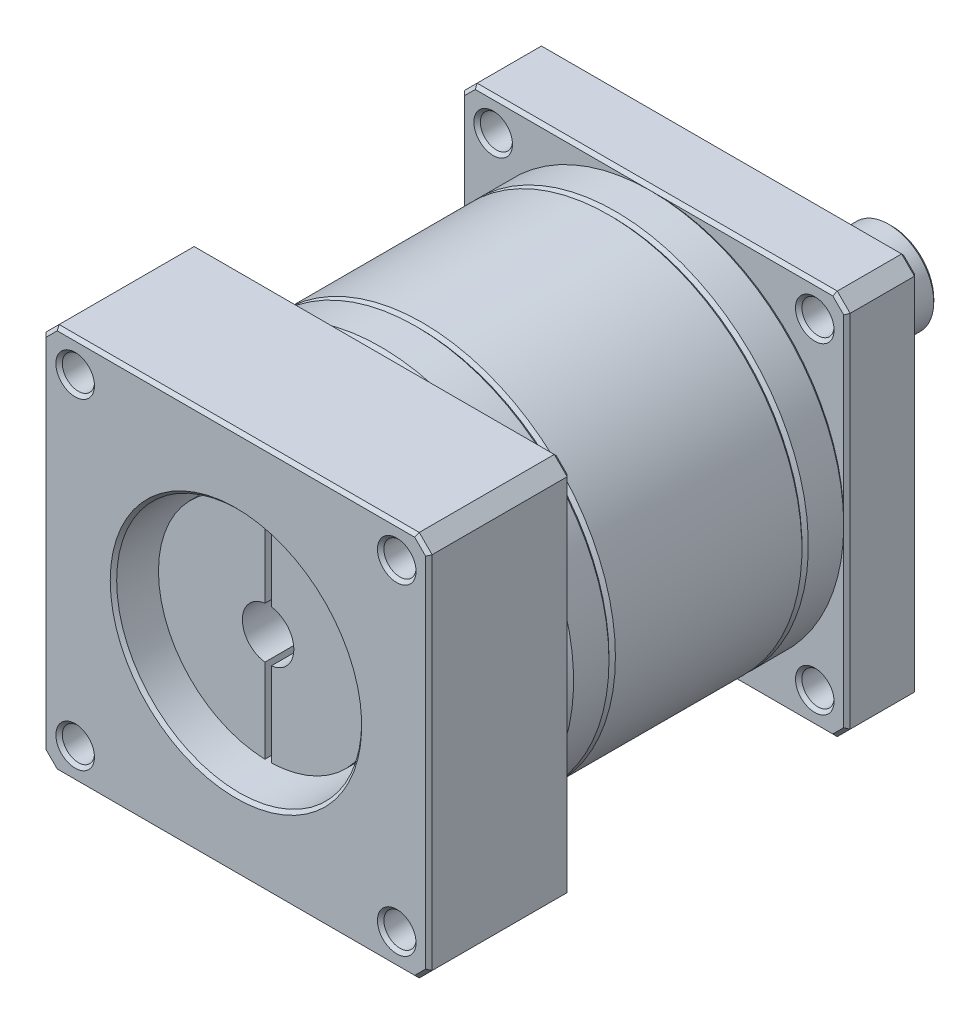
from build123d import *

# Parameters (mm, degrees)
SKETCH1_W                = 60
SKETCH1_H                = 60
EXTRUDE1_DEPTH           = 11
SKETCH2_R                = 30
EXTRUDE2_DEPTH           = 76
SKETCH3_W                = 60
SKETCH3_H                = 60
EXTRUDE3_DEPTH           = 22
SKETCH4_R                = 2.5
EXTRUDE4_DEPTH           = 88.040220588
CHAMFER1_SIZE            = 2
SKETCH6_R                = 19.05
EXTRUDE5_DEPTH           = 5
SKETCH7_R                = 19.05
SKETCH7_R_2              = 17.05
SKETCH7_R_3              = 4
EXTRUDE6_DEPTH           = 26
SKETCH8_R                = 21
EXTRUDE7_DEPTH           = 3
SKETCH9_R                = 7
EXTRUDE8_DEPTH           = 26
SKETCH10_R               = 8
EXTRUDE9_DEPTH           = 6
SPLIT1_START             = -26
SPLIT1_OUTLINE_R         = 7
SPLIT1_DEPTH             = 76
SPLIT1_START_2           = -6
SPLIT1_2_OUTLINE_R       = 8
SPLIT1_2_OUTLINE_R_2     = 4
SPLIT1_2_DEPTH           = 77
SPLIT1_START_3           = -3
SPLIT1_3_OUTLINE_R       = 10
SPLIT1_3_OUTLINE_R_2     = 8
SPLIT1_3_DEPTH           = 74
SPLIT1_4_OUTLINE_R       = 15
SPLIT1_4_OUTLINE_R_2     = 10
SPLIT1_4_DEPTH           = 74
SPLIT1_5_OUTLINE_R       = 17
SPLIT1_5_OUTLINE_R_2     = 15
SPLIT1_5_DEPTH           = 74
SPLIT1_6_OUTLINE_R       = 17
SPLIT1_6_DEPTH           = 97
CHAMFER2_SIZE            = 0.2
CHAMFER3_SIZE            = 0.2
CHAMFER4_SIZE            = 0.2
CHAMFER5_SIZE            = 0.5
CHAMFER6_SIZE            = 0.5
CHAMFER7_SIZE            = 0.5
EXTRUDE10_DEPTH          = 21
SPLIT2_START             = 11
SPLIT2_OUTLINE_R         = 2.5
SPLIT2_DEPTH             = 65
SPLIT2_START_2           = 54
SPLIT2_2_OUTLINE_R       = 2.5
SPLIT2_2_OUTLINE_R_2     = 19.05
SPLIT2_2_DEPTH           = 22
SPLIT2_3_OUTLINE_R       = 30
SPLIT2_3_DEPTH           = 39
SPLIT2_START_3           = 50
SPLIT2_4_OUTLINE_R       = 30
SPLIT2_4_OUTLINE_R_2     = 19.05
SPLIT2_4_DEPTH           = 4
SPLIT2_5_DEPTH           = 17
SPLIT2_6_DEPTH           = 17
CHAMFER8_SIZE            = 0.5
CHAMFER9_SIZE            = 0.5
CHAMFER10_SIZE           = 0.5
CHAMFER11_SIZE           = 0.5
SPLIT3_SURFACE_1_1_BACK  = 133.68
SPLIT3_SURFACE_1_1_DEPTH = 267.36
SPLIT3_SURFACE_1_2_BACK  = 133.68
SPLIT3_SURFACE_1_2_DEPTH = 267.36
SPLIT3_SURFACE_2_3_BACK  = 133.68
SPLIT3_SURFACE_2_3_DEPTH = 267.36
SPLIT3_SURFACE_2_4_BACK  = 133.68
SPLIT3_SURFACE_2_4_DEPTH = 267.36
CHAMFER12_SIZE           = 0.5
CHAMFER13_SIZE           = 0.5
CHAMFER14_SIZE           = 0.5


# Read off the part's stored shape, not the designer's step: Split1, Split2
with BuildPart() as part:
    # Sketch1 → Extrude1 (new body)
    with BuildSketch(Plane.XY):
        Rectangle(SKETCH1_W, SKETCH1_H)
    extrude(amount=EXTRUDE1_DEPTH)

    # Sketch2 → Extrude2 (add)
    with BuildSketch(Plane(origin=(0, 0, 0), x_dir=(-1, 0, 0), z_dir=(0, 0, -1))):
        Circle(SKETCH2_R)
    extrude(amount=-EXTRUDE2_DEPTH)

    # Sketch3 → Extrude3 (add)
    with BuildSketch(Plane.XY.offset(76)):
        Rectangle(SKETCH3_W, SKETCH3_H)
    extrude(amount=-EXTRUDE3_DEPTH)

    # Sketch4 → Extrude4 (cut, through all)
    with BuildSketch(Plane(origin=(0, 0, 0), x_dir=(-1, 0, 0), z_dir=(0, 0, -1))):
        with Locations((-25, 25)):
            Circle(SKETCH4_R)
        with Locations((25, 25)):
            Circle(SKETCH4_R)
        with Locations((25, -25)):
            Circle(SKETCH4_R)
        with Locations((-25, -25)):
            Circle(SKETCH4_R)
    extrude(amount=-EXTRUDE4_DEPTH, mode=Mode.SUBTRACT)

    # Chamfer1
    chamfer1_edges = [part.edges().sort_by_distance(p)[0] for p in [
        (-30, 30, 65),
        (30, 30, 65),
        (30, -30, 65),
        (-30, -30, 65),
        (30, -30, 5.5),
        (-30, -30, 5.5),
        (-30, 30, 5.5),
        (30, 30, 5.5),
    ]]
    chamfer(chamfer1_edges, length=CHAMFER1_SIZE)

    # Sketch6 → Extrude5 (cut)
    with BuildSketch(Plane.XY.offset(76)):
        Circle(SKETCH6_R)
    extrude(amount=-EXTRUDE5_DEPTH, mode=Mode.SUBTRACT)

    # Sketch7 → Extrude6 (cut)
    # profile 1 of 2: a face of its own
    with BuildSketch(Plane.XY.offset(76)):
        Circle(SKETCH7_R)
        Circle(SKETCH7_R_2, mode=Mode.SUBTRACT)
    # profile 2 of 2: a face of its own
    with BuildSketch(Plane.XY.offset(76)):
        Circle(SKETCH7_R_3)
    extrude(amount=-EXTRUDE6_DEPTH, mode=Mode.SUBTRACT)

    # Sketch8 → Extrude7 (add)
    with BuildSketch(Plane(origin=(0, 0, 0), x_dir=(-1, 0, 0), z_dir=(0, 0, -1))):
        with Locations(Location((0, 0, 0), (0, 0, 180))):
            Circle(SKETCH8_R)
    extrude(amount=EXTRUDE7_DEPTH)

    # Sketch9 → Extrude8 (add)
    with BuildSketch(Plane(origin=(0, 0, 0), x_dir=(-1, 0, 0), z_dir=(0, 0, -1))):
        with Locations(Location((0, 0, 0), (0, 0, 180))):
            Circle(SKETCH9_R)
    extrude(amount=EXTRUDE8_DEPTH)

    # Sketch10 → Extrude9 (add)
    with BuildSketch(Plane(origin=(0, 0, 0), x_dir=(-1, 0, 0), z_dir=(0, 0, -1))):
        Circle(SKETCH10_R)
    extrude(amount=EXTRUDE9_DEPTH)

    # Split1 6 outline → Split1 6 (cut)
    with BuildSketch(Plane.XY.offset(SPLIT1_START)):
        Circle(SPLIT1_6_OUTLINE_R)
    extrude(amount=SPLIT1_6_DEPTH, mode=Mode.SUBTRACT)

    # Chamfer5
    chamfer5_edges = [part.edges().sort_by_distance(p)[0] for p in [
        (-21, 0, -3),
        (-17, 0, -3),
    ]]
    chamfer(chamfer5_edges, length=CHAMFER5_SIZE)


with BuildPart() as body_2:
    # Split1 outline → Split1 (new body)
    with BuildSketch(Plane.XY.offset(SPLIT1_START)):
        Circle(SPLIT1_OUTLINE_R)
    extrude(amount=SPLIT1_DEPTH)

    # Split1 2 outline → Split1 2 (add)
    with BuildSketch(Plane.XY.offset(SPLIT1_START_2)):
        Circle(SPLIT1_2_OUTLINE_R)
        Circle(SPLIT1_2_OUTLINE_R_2, mode=Mode.SUBTRACT)
    extrude(amount=SPLIT1_2_DEPTH)


with BuildPart() as body_3:
    # Split1 3 outline → Split1 3 (new body)
    with BuildSketch(Plane.XY.offset(SPLIT1_START_3)):
        Circle(SPLIT1_3_OUTLINE_R)
        Circle(SPLIT1_3_OUTLINE_R_2, mode=Mode.SUBTRACT)
    extrude(amount=SPLIT1_3_DEPTH)

    # Chamfer2
    chamfer2_edges = [body_3.edges().sort_by_distance(p)[0] for p in [
        (-8, 0, -3),
        (-10, 0, -3),
    ]]
    chamfer(chamfer2_edges, length=CHAMFER2_SIZE)


with BuildPart() as body_4:
    # Split1 4 outline → Split1 4 (new body)
    with BuildSketch(Plane.XY.offset(SPLIT1_START_3)):
        Circle(SPLIT1_4_OUTLINE_R)
        Circle(SPLIT1_4_OUTLINE_R_2, mode=Mode.SUBTRACT)
    extrude(amount=SPLIT1_4_DEPTH)

    # Chamfer3
    chamfer3_edges = [body_4.edges().sort_by_distance(p)[0] for p in [
        (-15, 0, -3),
        (-10, 0, -3),
    ]]
    chamfer(chamfer3_edges, length=CHAMFER3_SIZE)


with BuildPart() as body_5:
    # Split1 5 outline → Split1 5 (new body)
    with BuildSketch(Plane.XY.offset(SPLIT1_START_3)):
        Circle(SPLIT1_5_OUTLINE_R)
        Circle(SPLIT1_5_OUTLINE_R_2, mode=Mode.SUBTRACT)
    extrude(amount=SPLIT1_5_DEPTH)

    # Chamfer4
    chamfer4_edges = [body_5.edges().sort_by_distance(p)[0] for p in [
        (-17, 0, -3),
        (-15, 0, -3),
    ]]
    chamfer(chamfer4_edges, length=CHAMFER4_SIZE)


with BuildPart() as part_1:
    add(part.part)

    # Combine1: union body 5, body 4, body 3, body 2
    add(body_5.part)
    add(body_4.part)
    add(body_3.part)
    add(body_2.part)

    # Chamfer6
    chamfer6_edges = [part_1.edges().sort_by_distance(p)[0] for p in [
        (-8, 0, -6),
    ]]
    chamfer(chamfer6_edges, length=CHAMFER6_SIZE)

    # Chamfer7
    chamfer7_edges = [part_1.edges().sort_by_distance(p)[0] for p in [
        (-7, 0, -26),
    ]]
    chamfer(chamfer7_edges, length=CHAMFER7_SIZE)

    # Sketch12 → Extrude10 (cut)
    with BuildSketch(Plane.XY.offset(71)):
        with BuildLine():
            Line((0.5, 17.05), (0.5, -17.05))
            ThreePointArc((0.5, -17.05), (0, -17.55), (-0.5, -17.05))
            Line((-0.5, -17.05), (-0.5, 17.05))
            ThreePointArc((-0.5, 17.05), (0, 17.55), (0.5, 17.05))
        make_face()
    extrude(amount=-EXTRUDE10_DEPTH, mode=Mode.SUBTRACT)

    # Split2 outline → Split2 (cut)
    with BuildSketch(Plane.XY.offset(SPLIT2_START)):
        Polygon((30, -28), (30, 28), (28, 30), (-28, 30), (-30, 28), (-30, -28), (-28, -30), (28, -30), align=None)
        with Locations((25, -25)):
            Circle(SPLIT2_OUTLINE_R, mode=Mode.SUBTRACT)
        with Locations((-25, -25)):
            Circle(SPLIT2_OUTLINE_R, mode=Mode.SUBTRACT)
        with Locations((-25, 25)):
            Circle(SPLIT2_OUTLINE_R, mode=Mode.SUBTRACT)
        with Locations((25, 25)):
            Circle(SPLIT2_OUTLINE_R, mode=Mode.SUBTRACT)
    extrude(amount=SPLIT2_DEPTH, mode=Mode.SUBTRACT)

    # Chamfer10
    chamfer10_edges = [part_1.edges().sort_by_distance(p)[0] for p in [
        (29, 29, 11),
        (-29, 29, 11),
        (29, -29, 11),
        (-29, -29, 11),
        (-29, -29, 0),
        (29, -29, 0),
        (-29, 29, 0),
        (29, 29, 0),
        (0, -30, 11),
        (-30, 0, 11),
        (0, 30, 11),
        (30, 0, 11),
        (0, -30, 0),
        (-30, 0, 0),
        (0, 30, 0),
        (30, 0, 0),
        (27.5, -25, 11),
        (-22.5, -25, 11),
        (-22.5, 25, 11),
        (27.5, 25, 11),
    ]]
    chamfer(chamfer10_edges, length=CHAMFER10_SIZE)

    # Chamfer11
    chamfer11_edges = [part_1.edges().sort_by_distance(p)[0] for p in [
        (27.5, 25, 0),
        (-22.5, 25, 0),
        (-22.5, -25, 0),
        (27.5, -25, 0),
    ]]
    chamfer(chamfer11_edges, length=CHAMFER11_SIZE)


with BuildPart() as body_2_2:
    # Split2 2 outline → Split2 2 (new body)
    with BuildSketch(Plane.XY.offset(SPLIT2_START_2)):
        Polygon((30, 28), (28, 30), (-28, 30), (-30, 28), (-30, -28), (-28, -30), (28, -30), (30, -28), align=None)
        with Locations((-25, -25)):
            Circle(SPLIT2_2_OUTLINE_R, mode=Mode.SUBTRACT)
        with Locations((25, -25)):
            Circle(SPLIT2_2_OUTLINE_R, mode=Mode.SUBTRACT)
        with Locations((-25, 25)):
            Circle(SPLIT2_2_OUTLINE_R, mode=Mode.SUBTRACT)
        Circle(SPLIT2_2_OUTLINE_R_2, mode=Mode.SUBTRACT)
        with Locations((25, 25)):
            Circle(SPLIT2_2_OUTLINE_R, mode=Mode.SUBTRACT)
    extrude(amount=SPLIT2_2_DEPTH)

    # Chamfer9
    chamfer9_edges = [body_2_2.edges().sort_by_distance(p)[0] for p in [
        (29, 29, 54),
        (-29, 29, 54),
        (29, -29, 54),
        (-29, -29, 54),
        (-29, -29, 76),
        (29, -29, 76),
        (-29, 29, 76),
        (29, 29, 76),
        (30, 0, 54),
        (0, -30, 54),
        (-30, 0, 54),
        (0, 30, 54),
        (30, 0, 76),
        (0, -30, 76),
        (-30, 0, 76),
        (0, 30, 76),
        (22.5, -25, 54),
        (-27.5, -25, 54),
        (-27.5, 25, 54),
        (22.5, 25, 54),
        (22.5, 25, 76),
        (-27.5, 25, 76),
        (-27.5, -25, 76),
        (22.5, -25, 76),
        (-19.05, 0, 76),
        (-19.05, 0, 54),
    ]]
    chamfer(chamfer9_edges, length=CHAMFER9_SIZE)


with BuildPart() as body_3_2:
    # Split2 3 outline → Split2 3 (new body)
    with BuildSketch(Plane.XY.offset(SPLIT2_START)):
        Circle(SPLIT2_3_OUTLINE_R)
    extrude(amount=SPLIT2_3_DEPTH)

    # Split2 4 outline → Split2 4 (add)
    # profile 1 of 3: a face of its own
    with BuildSketch(Plane.XY.offset(SPLIT2_START_3)):
        Circle(SPLIT2_4_OUTLINE_R)
        Circle(SPLIT2_4_OUTLINE_R_2, mode=Mode.SUBTRACT)
    # profile 2 of 3: a face of its own
    with BuildSketch(Plane.XY.offset(SPLIT2_START_3)):
        with BuildLine():
            ThreePointArc((0.5, 3.968626967), (4, 0), (0.5, -3.968626967))
            Line((0.5, -3.968626967), (0.5, -17.042667045))
            ThreePointArc((0.5, -17.042667045), (17.05, 0), (0.5, 17.042667045))
            Line((0.5, 17.042667045), (0.5, 3.968626967))
        make_face()
    # profile 3 of 3: a face of its own
    with BuildSketch(Plane.XY.offset(SPLIT2_START_3)):
        with BuildLine():
            Line((-0.5, 3.968626967), (-0.5, 17.042667045))
            ThreePointArc((-0.5, 17.042667045), (-17.05, 0), (-0.5, -17.042667045))
            Line((-0.5, -17.042667045), (-0.5, -3.968626967))
            ThreePointArc((-0.5, -3.968626967), (-4, 0), (-0.5, 3.968626967))
        make_face()
    extrude(amount=SPLIT2_4_DEPTH)

    # Chamfer8
    chamfer8_edges = [body_3_2.edges().sort_by_distance(p)[0] for p in [
        (-30, 0, 54),
        (-30, 0, 11),
    ]]
    chamfer(chamfer8_edges, length=CHAMFER8_SIZE)


with BuildPart() as body_4_2:
    # Split2 5 outline → Split2 5 (new body)
    with BuildSketch(Plane.XY.offset(SPLIT2_START_2)):
        with BuildLine():
            Line((-0.5, 3.968626967), (-0.5, 17.042667045))
            ThreePointArc((-0.5, 17.042667045), (-17.05, 0), (-0.5, -17.042667045))
            Line((-0.5, -17.042667045), (-0.5, -3.968626967))
            ThreePointArc((-0.5, -3.968626967), (-4, 0), (-0.5, 3.968626967))
        make_face()
    extrude(amount=SPLIT2_5_DEPTH)


with BuildPart() as body_5_2:
    # Split2 6 outline → Split2 6 (new body)
    with BuildSketch(Plane.XY.offset(SPLIT2_START_2)):
        with BuildLine():
            ThreePointArc((0.5, 3.968626967), (4, 0), (0.5, -3.968626967))
            Line((0.5, -3.968626967), (0.5, -17.042667045))
            ThreePointArc((0.5, -17.042667045), (17.05, 0), (0.5, 17.042667045))
            Line((0.5, 17.042667045), (0.5, 3.968626967))
        make_face()
    extrude(amount=SPLIT2_6_DEPTH)

    # Combine2: union body 4 2, body 3 2, body 2 2, part
    add(body_4_2.part)
    add(body_3_2.part)
    add(body_2_2.part)
    add(part_1.part)


with BuildPart() as body_2_3:
    # Split3: the piece behind the surface
    add(body_5_2.part)
    # Split3 surface 1: a surface, the sketch's curves swept straight by 267.36 mm
    with BuildLine(Plane(origin=(0, 0, 0), x_dir=(1, 0, 0), z_dir=(0, 1, 0)).offset(-SPLIT3_SURFACE_1_1_BACK), mode=Mode.PRIVATE) as split3_surface_1_1_path:
        Line((30, -17.5), (-30, -17.5))
    split3_surface_1_1 = Shell.extrude(split3_surface_1_1_path.wire(), (0 * SPLIT3_SURFACE_1_1_DEPTH, 1 * SPLIT3_SURFACE_1_1_DEPTH, 0 * SPLIT3_SURFACE_1_1_DEPTH))
    split(bisect_by=split3_surface_1_1, keep=Keep.BOTTOM)

    # Chamfer13
    chamfer13_edges = [body_2_3.edges().sort_by_distance(p)[0] for p in [
        (0, -30, 17.5),
    ]]
    chamfer(chamfer13_edges, length=CHAMFER13_SIZE)


with BuildPart() as body_5_2_1:
    add(body_5_2.part)

    # Split3: split by a surface, the side it looks to stays
    # Split3 surface 1: a surface, the sketch's curves swept straight by 267.36 mm
    with BuildLine(Plane(origin=(0, 0, 0), x_dir=(1, 0, 0), z_dir=(0, 1, 0)).offset(-SPLIT3_SURFACE_1_2_BACK), mode=Mode.PRIVATE) as split3_surface_1_2_path:
        Line((30, -17.5), (-30, -17.5))
    split3_surface_1_2 = Shell.extrude(split3_surface_1_2_path.wire(), (0 * SPLIT3_SURFACE_1_2_DEPTH, 1 * SPLIT3_SURFACE_1_2_DEPTH, 0 * SPLIT3_SURFACE_1_2_DEPTH))
    split(bisect_by=split3_surface_1_2, keep=Keep.TOP)


with BuildPart() as body_3_3:
    # Split3 2: the piece behind the surface
    add(body_5_2_1.part)
    # Split3 surface 2: a surface, the sketch's curves swept straight by 267.36 mm
    with BuildLine(Plane(origin=(0, 0, 0), x_dir=(1, 0, 0), z_dir=(0, 1, 0)).offset(-SPLIT3_SURFACE_2_3_BACK), mode=Mode.PRIVATE) as split3_surface_2_3_path:
        Line((-30, -47.5), (30, -47.5))
    split3_surface_2_3 = Shell.extrude(split3_surface_2_3_path.wire(), (0 * SPLIT3_SURFACE_2_3_DEPTH, 1 * SPLIT3_SURFACE_2_3_DEPTH, 0 * SPLIT3_SURFACE_2_3_DEPTH))
    split(bisect_by=split3_surface_2_3, keep=Keep.BOTTOM)

    # Chamfer14
    chamfer14_edges = [body_3_3.edges().sort_by_distance(p)[0] for p in [
        (0, 30, 47.5),
    ]]
    chamfer(chamfer14_edges, length=CHAMFER14_SIZE)


with BuildPart() as body_5_2_2:
    add(body_5_2_1.part)

    # Split3 2: split by a surface, the side it looks to stays
    # Split3 surface 2: a surface, the sketch's curves swept straight by 267.36 mm
    with BuildLine(Plane(origin=(0, 0, 0), x_dir=(1, 0, 0), z_dir=(0, 1, 0)).offset(-SPLIT3_SURFACE_2_4_BACK), mode=Mode.PRIVATE) as split3_surface_2_4_path:
        Line((-30, -47.5), (30, -47.5))
    split3_surface_2_4 = Shell.extrude(split3_surface_2_4_path.wire(), (0 * SPLIT3_SURFACE_2_4_DEPTH, 1 * SPLIT3_SURFACE_2_4_DEPTH, 0 * SPLIT3_SURFACE_2_4_DEPTH))
    split(bisect_by=split3_surface_2_4, keep=Keep.TOP)

    # Chamfer12
    chamfer12_edges = [body_5_2_2.edges().sort_by_distance(p)[0] for p in [
        (0, -30, 47.5),
        (0, 30, 17.5),
    ]]
    chamfer(chamfer12_edges, length=CHAMFER12_SIZE)


with BuildPart() as body_2_3_1:
    add(body_2_3.part)

    # Combine3: union body 5 2, body 3 3
    add(body_5_2_2.part)
    add(body_3_3.part)


solid = body_2_3_1.part
